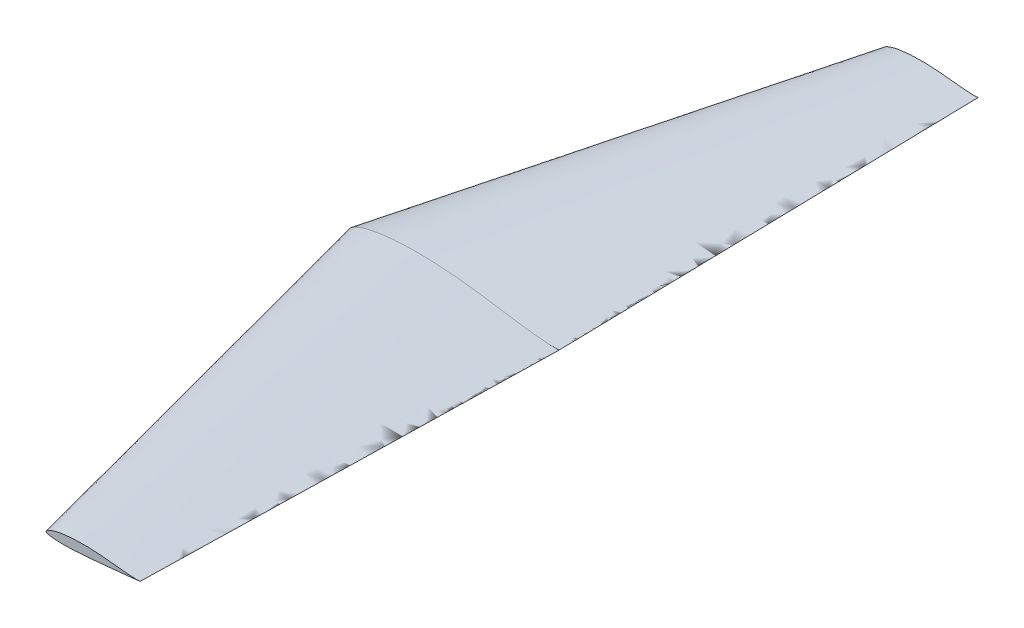
from build123d import *


with BuildPart() as part:
    # Loft3: read off the stored shape, not the designer's step
    # Loft3: loft between two sections, ruled curve by curve
    loft3_from = [
        Edge.make_bspline([(45.0454161, 2.460302649, 200), (45.042914539, 2.46595709, 200), (45.039557139, 2.475343752, 200), (45.035780086, 2.495269147, 200), (45.035792001, 2.515851182, 200), (45.039243728, 2.542487911, 200), (45.047333149, 2.576418208, 200), (45.060567901, 2.613277752, 200), (45.082233887, 2.660759277, 200), (45.103691595, 2.699240311, 200), (45.154957547, 2.779314135, 200), (45.206749705, 2.843305967, 200), (45.370067066, 3.020396897, 200), (45.5178348, 3.140760784, 200), (45.849467174, 3.376297927, 200), (46.062513558, 3.502795425, 200), (46.523459294, 3.747684578, 200), (46.801312816, 3.875512999, 200), (47.389306599, 4.120890072, 200), (47.729585347, 4.24643325, 200), (48.439583382, 4.485401741, 200), (48.839691677, 4.605596381, 200), (49.665618702, 4.832242705, 200), (50.121989228, 4.944402869, 200), (51.056183738, 5.153111109, 200), (51.564710515, 5.25434988, 200), (52.599275901, 5.438980088, 200), (53.156148181, 5.525991816, 200), (54.283545179, 5.681355688, 200), (54.884982358, 5.752408106, 200), (56.096851983, 5.875859352, 200), (56.738244711, 5.93017077, 200), (58.024805873, 6.020246347, 200), (58.700963836, 6.057196401, 200), (60.051144787, 6.113321512, 200), (60.756169604, 6.133054903, 200), (62.157650242, 6.155168203, 200), (62.885110308, 6.157498766, 200), (64.325143337, 6.145262943, 200), (65.068712016, 6.130055124, 200), (66.534782102, 6.083740506, 200), (67.288261361, 6.051427939, 200), (68.768327405, 5.972068227, 200), (69.52586496, 5.923260465, 200), (71.008607691, 5.813544884, 200), (71.764730789, 5.750369108, 200), (73.239182958, 5.615098445, 200), (73.988393759, 5.540279781, 200), (75.443654279, 5.387199839, 200), (76.180551715, 5.305844717, 200), (77.603248626, 5.147807454, 200), (78.319869369, 5.067774159, 200), (79.691555588, 4.918156786, 200), (80.377425831, 4.845083509, 200), (81.676286654, 4.713663401, 200), (82.320086568, 4.651779901, 200), (83.524166942, 4.546149158, 200), (84.11522081, 4.498854738, 200), (85.19936925, 4.424320964, 200), (85.723455147, 4.393562728, 200), (86.669352027, 4.352566295, 200), (87.121352345, 4.338836336, 200), (87.891121206, 4.324170028, 200), (88.242489723, 4.320773182, 200), (88.862993294, 4.333317472, 200), (89.153696352, 4.3449701, 200), (89.504173792, 4.361252758, 200), (89.625933035, 4.367541808, 200), (89.888787398, 4.396740628, 200), (89.984532375, 4.408303302, 200), (90.011918881, 4.409061737, 200), (89.939586548, 4.396458656, 200), (89.694501309, 4.354867576, 200), (89.579188023, 4.333888527, 200), (89.282819205, 4.285180519, 200), (89.038142327, 4.250628496, 200), (88.511130556, 4.181197301, 200), (88.208624679, 4.145508945, 200), (87.547666878, 4.069648273, 200), (87.155104181, 4.025931734, 200), (86.328927253, 3.936156828, 200), (85.865376553, 3.8872876, 200), (84.898827722, 3.78647156, 200), (84.364724841, 3.731417498, 200), (83.265109188, 3.619140422, 200), (82.66880888, 3.55890053, 200), (81.451689193, 3.43648588, 200), (80.800000961, 3.371250189, 200), (79.480148011, 3.240045048, 200), (78.78112988, 3.17107971, 200), (77.374921029, 3.033060832, 200), (76.636871022, 2.961016848, 200), (75.161439508, 2.818027142, 200), (74.393195698, 2.744135628, 200), (72.866659749, 2.598369107, 200), (72.077502405, 2.523575882, 200), (70.518627437, 2.377595757, 200), (69.71803927, 2.303548393, 200), (68.145956616, 2.160445397, 200), (67.343586282, 2.088587127, 200), (65.777370388, 1.952045995, 200), (64.982641706, 1.884642217, 200), (63.440873505, 1.758860848, 200), (62.662942261, 1.697861105, 200), (61.163160421, 1.587609399, 200), (60.410407838, 1.535853372, 200), (58.968575098, 1.445858658, 200), (58.248578071, 1.405289683, 200), (56.879014711, 1.339775638, 200), (56.198513211, 1.312706513, 200), (54.913800008, 1.274999011, 200), (54.278627859, 1.262545484, 200), (53.089860352, 1.254680282, 200), (52.505274959, 1.257817963, 200), (51.422250678, 1.280480933, 200), (50.892787917, 1.299046754, 200), (49.924031272, 1.351877705, 200), (49.453676233, 1.385718999, 200), (48.606410084, 1.466751144, 200), (48.198394716, 1.514251032, 200), (47.479036399, 1.619279877, 200), (47.136566558, 1.677936414, 200), (46.55218247, 1.801647832, 200), (46.278984452, 1.868603366, 200), (45.83524503, 2.003497675, 200), (45.633408447, 2.074121582, 200), (45.395486225, 2.188655762, 200), (45.322927253, 2.227332251, 200), (45.238509739, 2.279297214, 200), (45.198472471, 2.305891068, 200), (45.151439262, 2.341126536, 200), (45.119362982, 2.367975647, 200), (45.09210796, 2.395077865, 200), (45.073572107, 2.415718236, 200), (45.060584271, 2.432906734, 200), (45.050862693, 2.449006779, 200), (45.047112787, 2.456467518, 200), (45.0454161, 2.460302649, 200)], [0, 0, 0, 0, 0.000202605, 0.0003272, 0.000667222, 0.000868135, 0.001208158, 0.001813288, 0.002153311, 0.002920768, 0.00326079, 0.005279311, 0.005619334, 0.011171473, 0.011511496, 0.018970949, 0.019310971, 0.028680065, 0.029020088, 0.040265768, 0.04060579, 0.053664546, 0.054004568, 0.068781709, 0.069121731, 0.085496746, 0.085836768, 0.103696783, 0.104036805, 0.123279154, 0.123619176, 0.144114651, 0.144454673, 0.166052198, 0.16639222, 0.188915849, 0.189255872, 0.212508867, 0.212848889, 0.236637072, 0.236977094, 0.261109164, 0.261449186, 0.285743957, 0.286083979, 0.310367619, 0.310707642, 0.334800339, 0.335140361, 0.35885315, 0.359193172, 0.382238655, 0.382578677, 0.404591708, 0.40493173, 0.425535483, 0.425875505, 0.444690032, 0.445030054, 0.461664045, 0.462004067, 0.476076707, 0.476416729, 0.487631556, 0.487971579, 0.496071926, 0.496411949, 0.501149875, 0.501489897, 0.502818769, 0.503158791, 0.504398911, 0.504738934, 0.508909268, 0.509249291, 0.516130739, 0.516470761, 0.526063375, 0.526403398, 0.538622748, 0.538962771, 0.553653331, 0.553993353, 0.570968307, 0.571308329, 0.590351501, 0.590691523, 0.611559648, 0.611899671, 0.634331017, 0.634671039, 0.658389951, 0.658729974, 0.683443691, 0.683783713, 0.709185199, 0.709525222, 0.735298883, 0.735638905, 0.761464393, 0.761804416, 0.78736664, 0.787706662, 0.812700751, 0.813040774, 0.837186122, 0.837526144, 0.860572525, 0.860912547, 0.882639149, 0.882979171, 0.903200127, 0.90354015, 0.922092342, 0.922432364, 0.939180643, 0.939520666, 0.954352054, 0.954692076, 0.967523226, 0.967863249, 0.978606049, 0.978946071, 0.98751778, 0.987857802, 0.99418269, 0.994522712, 0.996543042, 0.996883064, 0.99778343, 0.998123453, 0.998815106, 0.999155128, 0.999387491, 0.999727513, 0.999862583, 1, 1, 1, 1], 3),
    ]
    loft3_to = [
        Edge.make_bspline([(-9.999066939, -0.022999871, 0), (-10.000211771, -0.009341009, 0), (-10.000276227, 0.012959214, 0), (-9.99602238, 0.058262169, 0), (-9.986866912, 0.102365001, 0), (-9.969684316, 0.159374659, 0), (-9.942670757, 0.231992729, 0), (-9.904671108, 0.310404205, 0), (-9.847139045, 0.410895559, 0), (-9.792525006, 0.492150533, 0), (-9.665744331, 0.66104282, 0), (-9.541380012, 0.795373983, 0), (-9.156182227, 1.166640802, 0), (-8.813702, 1.416071842, 0), (-8.052063056, 1.902153069, 0), (-7.565733038, 2.160212413, 0), (-6.517394122, 2.656235835, 0), (-5.887662209, 2.911821977, 0), (-4.558038517, 3.397887152, 0), (-3.790277039, 3.642958879, 0), (-2.190803699, 4.103918604, 0), (-1.290902211, 4.331770183, 0), (0.564518463, 4.754881239, 0), (1.588456152, 4.95978477, 0), (3.682391039, 5.333131181, 0), (4.821019943, 5.508979481, 0), (7.135408927, 5.819532944, 0), (8.379974403, 5.959321027, 0), (10.897602087, 6.196334343, 0), (12.239556591, 6.296590629, 0), (14.941638117, 6.454989121, 0), (16.37068596, 6.514403817, 0), (19.235388729, 6.591815651, 0), (20.739957426, 6.609488917, 0), (23.742660924, 6.605685125, 0), (25.309675534, 6.582478175, 0), (28.423032775, 6.498418082, 0), (30.038200946, 6.434498419, 0), (33.233884516, 6.27060285, 0), (34.883150281, 6.166258768, 0), (38.133405697, 5.924313057, 0), (39.803051791, 5.781088965, 0), (43.081246949, 5.464508013, 0), (44.758342129, 5.284322593, 0), (48.039613143, 4.900213265, 0), (49.712213453, 4.688326583, 0), (52.972673894, 4.248396225, 0), (54.628839959, 4.011413896, 0), (57.845045992, 3.534016403, 0), (59.473283596, 3.283856532, 0), (62.616792037, 2.798935732, 0), (64.200167693, 2.553799701, 0), (67.23127313, 2.092660898, 0), (68.747054884, 1.866007689, 0), (71.618219313, 1.452365443, 0), (73.041684522, 1.254643908, 0), (75.704944603, 0.907433163, 0), (77.012660753, 0.747202428, 0), (79.41242869, 0.480584212, 0), (80.573170895, 0.363513488, 0), (82.669823874, 0.184638663, 0), (83.671654733, 0.112170469, 0), (85.377545326, 0.008127324, 0), (86.158558985, -0.031611057, 0), (87.542779178, -0.060023403, 0), (88.185088613, -0.060919118, 0), (88.948525163, -0.057395153, 0), (89.232481119, -0.052576202, 0), (89.857507843, -0.007202768, 0), (90.03176126, 0.005648344, 0), (89.960962934, -0.008661803, 0), (89.761837562, -0.033576677, 0), (89.250339277, -0.098764777, 0), (89.00454261, -0.132777241, 0), (88.326877366, -0.213049526, 0), (87.776519265, -0.266395361, 0), (86.604921799, -0.36941851, 0), (85.931128084, -0.41966393, 0), (84.455065987, -0.525649634, 0), (83.579100179, -0.585603093, 0), (81.736971655, -0.706779847, 0), (80.7033725, -0.771496048, 0), (78.547980927, -0.904162744, 0), (77.357048066, -0.97602042, 0), (74.905344361, -1.121595492, 0), (73.575881143, -1.199120118, 0), (70.862314427, -1.356185771, 0), (69.409409017, -1.43959203, 0), (66.466958029, -1.606469849, 0), (64.908631041, -1.693695288, 0), (61.773824057, -1.867583069, 0), (60.128555066, -1.957966686, 0), (56.839604819, -2.136351053, 0), (55.127131172, -2.227987562, 0), (51.724466678, -2.407723558, 0), (49.965479266, -2.499381986, 0), (46.490999765, -2.676505755, 0), (44.706705254, -2.765413759, 0), (41.203174335, -2.934876738, 0), (39.415128481, -3.018728418, 0), (35.925236799, -3.174094289, 0), (34.154573829, -3.248736376, 0), (30.719968032, -3.382443244, 0), (28.987197755, -3.444392966, 0), (25.647262742, -3.547430434, 0), (23.971260117, -3.591160459, 0), (20.761883156, -3.65456051, 0), (19.159654451, -3.676458887, 0), (16.113029456, -3.692128998, 0), (14.599758905, -3.687686381, 0), (11.744137437, -3.649453977, 0), (10.332886861, -3.616734305, 0), (7.693105412, -3.521070956, 0), (6.395645693, -3.458391132, 0), (3.993535414, -3.304704063, 0), (2.819932957, -3.212824826, 0), (0.674413342, -3.002610769, 0), (-0.366479708, -2.882217722, 0), (-2.239515788, -2.620522382, 0), (-3.140653855, -2.475476272, 0), (-4.727316226, -2.172138447, 0), (-5.481740188, -2.008179884, 0), (-6.766615733, -1.675377967, 0), (-7.366241464, -1.498994004, 0), (-8.337392331, -1.153529974, 0), (-8.777250512, -0.974272218, 0), (-9.291473506, -0.691407945, 0), (-9.447442432, -0.596324367, 0), (-9.627599427, -0.469568525, 0), (-9.712231579, -0.404426353, 0), (-9.810453786, -0.318109777, 0), (-9.875768831, -0.252141995, 0), (-9.929399172, -0.185646495, 0), (-9.963316931, -0.133990523, 0), (-9.984750558, -0.090373782, 0), (-9.995742857, -0.050497524, 0), (-9.998290455, -0.032264012, 0), (-9.999066939, -0.022999871, 0)], [0, 0, 0, 0, 0.000202605, 0.0003272, 0.000667222, 0.000868135, 0.001208158, 0.001813288, 0.002153311, 0.002920768, 0.00326079, 0.005279311, 0.005619334, 0.011171473, 0.011511496, 0.018970949, 0.019310971, 0.028680065, 0.029020088, 0.040265768, 0.04060579, 0.053664546, 0.054004568, 0.068781709, 0.069121731, 0.085496746, 0.085836768, 0.103696783, 0.104036805, 0.123279154, 0.123619176, 0.144114651, 0.144454673, 0.166052198, 0.16639222, 0.188915849, 0.189255872, 0.212508867, 0.212848889, 0.236637072, 0.236977094, 0.261109164, 0.261449186, 0.285743957, 0.286083979, 0.310367619, 0.310707642, 0.334800339, 0.335140361, 0.35885315, 0.359193172, 0.382238655, 0.382578677, 0.404591708, 0.40493173, 0.425535483, 0.425875505, 0.444690032, 0.445030054, 0.461664045, 0.462004067, 0.476076707, 0.476416729, 0.487631556, 0.487971579, 0.496071926, 0.496411949, 0.501149875, 0.501489897, 0.502818769, 0.503158791, 0.504398911, 0.504738934, 0.508909268, 0.509249291, 0.516130739, 0.516470761, 0.526063375, 0.526403398, 0.538622748, 0.538962771, 0.553653331, 0.553993353, 0.570968307, 0.571308329, 0.590351501, 0.590691523, 0.611559648, 0.611899671, 0.634331017, 0.634671039, 0.658389951, 0.658729974, 0.683443691, 0.683783713, 0.709185199, 0.709525222, 0.735298883, 0.735638905, 0.761464393, 0.761804416, 0.78736664, 0.787706662, 0.812700751, 0.813040774, 0.837186122, 0.837526144, 0.860572525, 0.860912547, 0.882639149, 0.882979171, 0.903200127, 0.90354015, 0.922092342, 0.922432364, 0.939180643, 0.939520666, 0.954352054, 0.954692076, 0.967523226, 0.967863249, 0.978606049, 0.978946071, 0.98751778, 0.987857802, 0.99418269, 0.994522712, 0.996543042, 0.996883064, 0.99778343, 0.998123453, 0.998815106, 0.999155128, 0.999387491, 0.999727513, 0.999862583, 1, 1, 1, 1], 3),
    ]
    loft3 = Solid(Shell([*[Face.make_surface_from_curves(loft3_from[k], loft3_to[k]) for k in range(1)], Face(Wire(loft3_from)), Face(Wire(loft3_to))]))
    add(loft3)

    # Mirror1: Loft3 across plane
    add(loft3.mirror(Plane.XY))


solid = part.part
